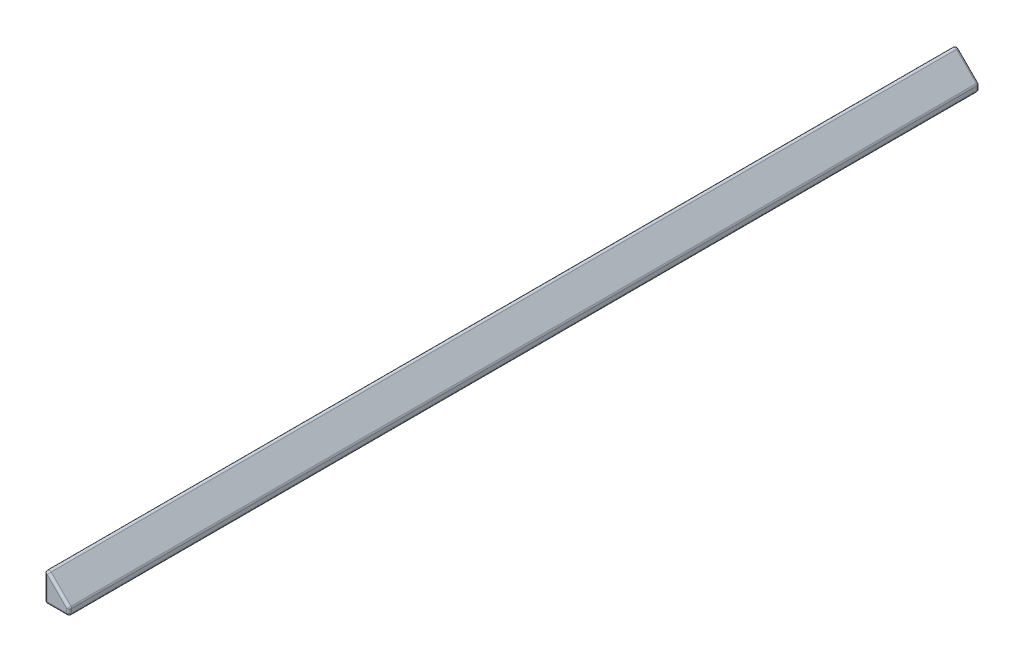
from build123d import *

# Parameters (mm, degrees)
BOSS_EXTRUDE1_DEPTH = 36.9
FILLET1_R           = 0.2


with BuildPart() as part:
    # Sketch1 → Boss-Extrude1 (new, symmetric)
    with BuildSketch(Plane.XY):
        Polygon((0, 2.6), (0, 0), (2, 0), (2, 0.6), align=None)
    extrude(amount=BOSS_EXTRUDE1_DEPTH, both=True)

    # Fillet1
    fillet1_edges = [part.edges().sort_by_distance(p)[0] for p in [
        (0, 2.6, 0),
        (0, 0, 0),
        (2, 0.6, 0),
        (2, 0, 0),
        (2, 0.3, -36.9),
        (1, 1.6, -36.9),
        (0, 1.3, -36.9),
        (1, 0, -36.9),
        (0, 1.3, 36.9),
        (1, 1.6, 36.9),
        (2, 0.3, 36.9),
        (1, 0, 36.9),
    ]]
    fillet(fillet1_edges, radius=FILLET1_R)


solid = part.part
